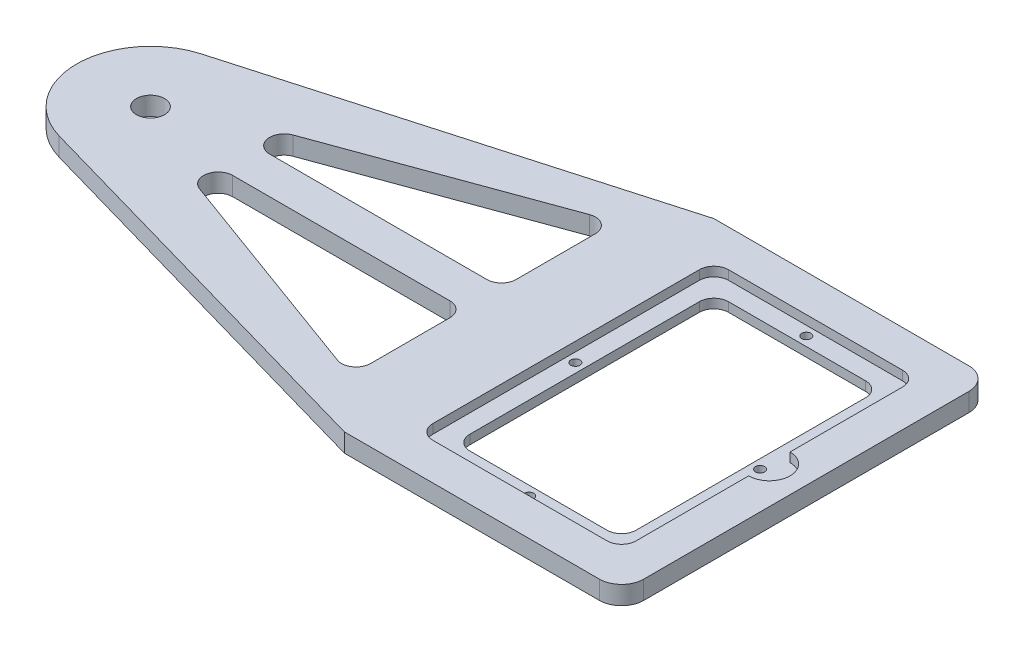
from build123d import *

# Parameters (mm, degrees)
SKETCH1_W           = 95.25
SKETCH1_H           = 127
BOSS_EXTRUDE1_DEPTH = 6.35
BOSS_EXTRUDE3_DEPTH = 6.35
SKETCH5_R           = 4.826
CUT_EXTRUDE1_DEPTH  = 213.985474857
CUT_EXTRUDE2_DEPTH  = 213.985474857
FILLET9_R           = 5
SKETCH7_R           = 5.453804141
BOSS_EXTRUDE4_DEPTH = 6.35
SKETCH8_W           = 69.85
SKETCH8_H           = 101.6
CUT_EXTRUDE3_DEPTH  = 3.175
SKETCH9_W           = 57.15
SKETCH9_H           = 88.9
CUT_EXTRUDE4_DEPTH  = 213.914467862
SKETCH11_R          = 1.5875
CUT_EXTRUDE6_DEPTH  = 213.914467862
CUT_EXTRUDE7_DEPTH  = 3.175
FILLET10_R          = 5
FILLET11_R          = 5
FILLET12_R          = 7.62


with BuildPart() as part:
    # Sketch1 → Boss-Extrude1 (new body)
    with BuildSketch(Plane(origin=(0, 0, 0), x_dir=(1, 0, 0), z_dir=(0, 1, 0))):
        Rectangle(SKETCH1_W, SKETCH1_H)
    extrude(amount=BOSS_EXTRUDE1_DEPTH)

    # Sketch4 → Boss-Extrude3 (add)
    with BuildSketch(Plane(origin=(0, 6.35, 0), x_dir=(1, 0, 0), z_dir=(0, 1, 0))):
        with BuildLine():
            Line((-47.625, 63.5), (-184.759922998, 24.427842145))
            ThreePointArc((-184.759922998, 24.427842145), (-203.2, 0), (-184.759922998, -24.427842145))
            Line((-184.759922998, -24.427842145), (-47.625, -63.5))
            Line((-47.625, -63.5), (-47.625, 63.5))
        make_face()
    extrude(amount=-BOSS_EXTRUDE3_DEPTH)

    # Sketch5 → Cut-Extrude1 (cut, through all)
    with BuildSketch(Plane(origin=(0, 6.35, 0), x_dir=(1, 0, 0), z_dir=(0, 1, 0))):
        with Locations((-177.8, 0)):
            Circle(SKETCH5_R)
        with Locations((-22.225, 0)):
            Circle(SKETCH5_R)
    extrude(amount=-CUT_EXTRUDE1_DEPTH, mode=Mode.SUBTRACT)

    # Sketch6 → Cut-Extrude2 (cut, through all)
    with BuildSketch(Plane(origin=(0, 6.35, 0), x_dir=(1, 0, 0), z_dir=(0, 1, 0))):
        Polygon((-63.5, 45.771509083), (-171.45, 6.35), (-63.5, 6.35), align=None)
        Polygon((-63.5, -6.35), (-63.5, -45.771509083), (-171.45, -6.35), align=None)
    extrude(amount=-CUT_EXTRUDE2_DEPTH, mode=Mode.SUBTRACT)

    # Fillet9
    fillet9_edges = [part.edges().sort_by_distance(p)[0] for p in [
        (-171.45, 3.175, 6.35),
        (-63.5, 3.175, 6.35),
        (-63.5, 3.175, 45.771509083),
        (-63.5, 3.175, -6.35),
        (-171.45, 3.175, -6.35),
        (-63.5, 3.175, -45.771509083),
    ]]
    fillet(fillet9_edges, radius=FILLET9_R)

    # Sketch7 → Boss-Extrude4 (add)
    with BuildSketch(Plane(origin=(0, 6.35, 0), x_dir=(1, 0, 0), z_dir=(0, 1, 0))):
        with Locations((-22.225, 0)):
            Circle(SKETCH7_R)
    extrude(amount=-BOSS_EXTRUDE4_DEPTH)

    # Sketch8 → Cut-Extrude3 (cut)
    with BuildSketch(Plane(origin=(0, 6.35, 0), x_dir=(1, 0, 0), z_dir=(0, 1, 0))):
        Rectangle(SKETCH8_W, SKETCH8_H)
    extrude(amount=-CUT_EXTRUDE3_DEPTH, mode=Mode.SUBTRACT)

    # Sketch9 → Cut-Extrude4 (cut, through all)
    with BuildSketch(Plane(origin=(0, 3.175, 0), x_dir=(1, 0, 0), z_dir=(0, 1, 0))):
        Rectangle(SKETCH9_W, SKETCH9_H)
    extrude(amount=-CUT_EXTRUDE4_DEPTH, mode=Mode.SUBTRACT)

    # Sketch11 → Cut-Extrude6 (cut, through all)
    with BuildSketch(Plane(origin=(0, 3.175, 0), x_dir=(1, 0, 0), z_dir=(0, 1, 0))):
        with Locations((-31.75, 0)):
            Circle(SKETCH11_R)
        with Locations((31.75, 0)):
            Circle(SKETCH11_R)
        with Locations((0, 47.625)):
            Circle(SKETCH11_R)
        with Locations((0, -47.625)):
            Circle(SKETCH11_R)
    extrude(amount=-CUT_EXTRUDE6_DEPTH, mode=Mode.SUBTRACT)

    # Sketch12 → Cut-Extrude7 (cut)
    with BuildSketch(Plane(origin=(0, 6.35, 0), x_dir=(1, 0, 0), z_dir=(0, 1, 0))):
        with BuildLine():
            Line((34.925, 7.112), (34.925, -7.112))
            ThreePointArc((34.925, -7.112), (42.037, 0), (34.925, 7.112))
        make_face()
    extrude(amount=-CUT_EXTRUDE7_DEPTH, mode=Mode.SUBTRACT)

    # Fillet10
    fillet10_edges = [part.edges().sort_by_distance(p)[0] for p in [
        (-34.925, 4.7625, 50.8),
        (34.925, 4.7625, 50.8),
        (34.925, 4.7625, -50.8),
        (-34.925, 4.7625, -50.8),
    ]]
    fillet(fillet10_edges, radius=FILLET10_R)

    # Fillet11
    fillet11_edges = [part.edges().sort_by_distance(p)[0] for p in [
        (-28.575, 1.5875, -44.45),
        (28.575, 1.5875, -44.45),
        (28.575, 1.5875, 44.45),
        (-28.575, 1.5875, 44.45),
    ]]
    fillet(fillet11_edges, radius=FILLET11_R)

    # Fillet12
    fillet12_edges = [part.edges().sort_by_distance(p)[0] for p in [
        (47.625, 3.175, -63.5),
        (47.625, 3.175, 63.5),
    ]]
    fillet(fillet12_edges, radius=FILLET12_R)


solid = part.part
